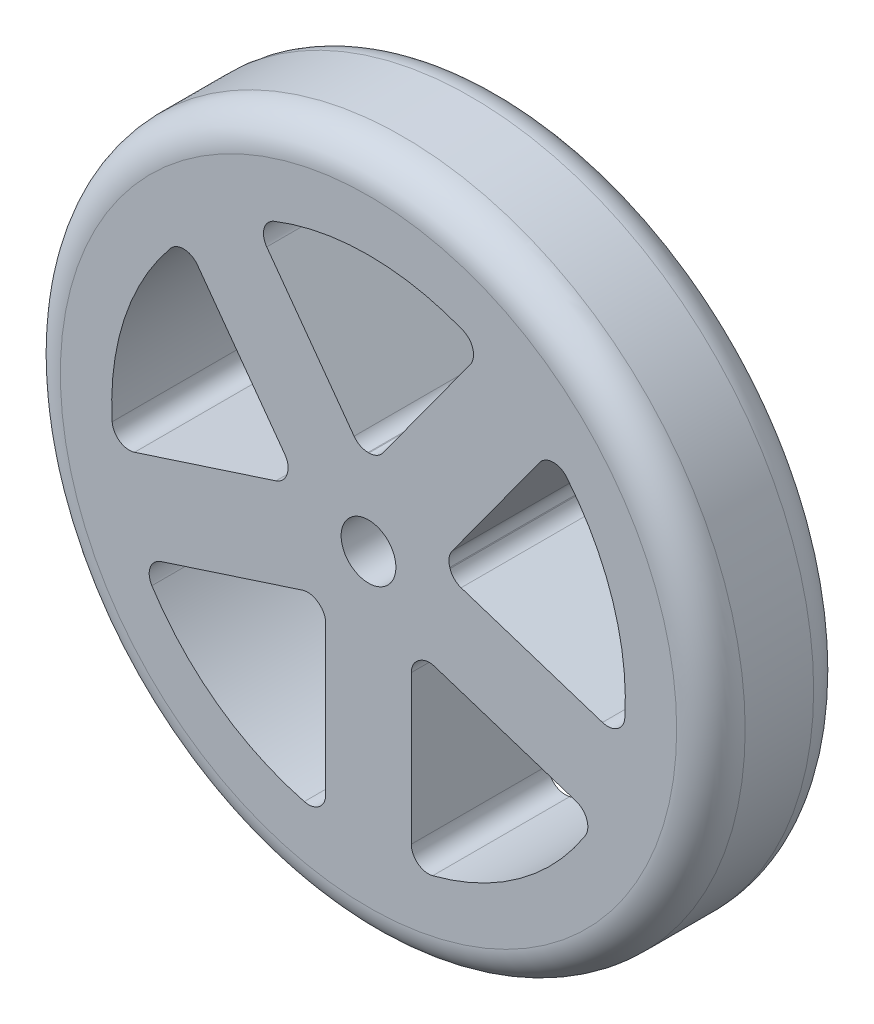
from build123d import *

# Parameters (mm, degrees)
ESQUISSE1_R                  = 100
BOSS_EXTRU_1_DEPTH           = 40
ENL_V_MAT_EXTRU_1_DEPTH      = 147.969384567
ENL_V_MAT_EXTRU_1_DEPTH_BACK = 147.969384567
ENL_V_MAT_EXTRU_2_DEPTH      = 147.969384567
ENL_V_MAT_EXTRU_2_DEPTH_BACK = 147.969384567
ESQUISSE3_R                  = 8
CONG_1_R                     = 5
CONG_2_R                     = 10


with BuildPart() as part:
    # Esquisse1 → Boss.-Extru.1 (new body)
    with BuildSketch(Plane.XY):
        Circle(ESQUISSE1_R)
    extrude(amount=BOSS_EXTRU_1_DEPTH)

    # Esquisse2 → Enlèv. mat.-Extru.1 (cut, two sides: drawn at the far end of the back side and taken through both)
    with BuildSketch(Plane.XY.offset(40).offset(-ENL_V_MAT_EXTRU_1_DEPTH_BACK)):
        with BuildLine():
            Line((2.613211582, 24.863047384), (33.354593169, 67.174929211))
            ThreePointArc((33.354593169, 67.174929211), (0, 75), (-33.354593169, 67.174929211))
            Line((-33.354593169, 67.174929211), (-2.613211582, 24.863047384))
            ThreePointArc((-2.613211582, 24.863047384), (0, 25), (2.613211582, 24.863047384))
        make_face()
        with BuildLine():
            Line((24.453690018, 5.19779227), (74.194290288, -10.96390846))
            ThreePointArc((74.194290288, -10.96390846), (71.329238722, 23.176274578), (53.580018028, 52.480297904))
            Line((53.580018028, 52.480297904), (22.838636441, 10.168416077))
            ThreePointArc((22.838636441, 10.168416077), (23.776412907, 7.725424859), (24.453690018, 5.19779227))
        make_face()
        with BuildLine():
            Line((12.5, -21.650635095), (12.5, -73.950997289))
            ThreePointArc((12.5, -73.950997289), (44.083893922, -60.676274578), (66.468865428, -34.740321367))
            Line((66.468865428, -34.740321367), (16.728265159, -18.578620637))
            ThreePointArc((16.728265159, -18.578620637), (14.694631307, -20.225424859), (12.5, -21.650635095))
        make_face()
        with BuildLine():
            Line((-16.728265159, -18.578620637), (-66.468865428, -34.740321367))
            ThreePointArc((-66.468865428, -34.740321367), (-44.083893922, -60.676274578), (-12.5, -73.950997289))
            Line((-12.5, -73.950997289), (-12.5, -21.650635095))
            ThreePointArc((-12.5, -21.650635095), (-14.694631307, -20.225424859), (-16.728265159, -18.578620637))
        make_face()
        with BuildLine():
            Line((-22.838636441, 10.168416077), (-53.580018028, 52.480297904))
            ThreePointArc((-53.580018028, 52.480297904), (-71.329238722, 23.176274578), (-74.194290288, -10.96390846))
            Line((-74.194290288, -10.96390846), (-24.453690018, 5.19779227))
            ThreePointArc((-24.453690018, 5.19779227), (-23.776412907, 7.725424859), (-22.838636441, 10.168416077))
        make_face()
    extrude(amount=ENL_V_MAT_EXTRU_1_DEPTH + ENL_V_MAT_EXTRU_1_DEPTH_BACK, mode=Mode.SUBTRACT)

    # Esquisse3 → Enlèv. mat.-Extru.2 (cut, two sides: drawn at the far end of the back side and taken through both)
    with BuildSketch(Plane.XY.offset(40).offset(-ENL_V_MAT_EXTRU_2_DEPTH_BACK)):
        Circle(ESQUISSE3_R)
    extrude(amount=ENL_V_MAT_EXTRU_2_DEPTH + ENL_V_MAT_EXTRU_2_DEPTH_BACK, mode=Mode.SUBTRACT)

    # Congé1
    cong_1_edges = [part.edges().sort_by_distance(p)[0] for p in [
        (-24.453690018, 5.19779227, 20),
        (-22.838636441, 10.168416077, 20),
        (-2.613211582, 24.863047384, 20),
        (2.613211582, 24.863047384, 20),
        (22.838636441, 10.168416077, 20),
        (24.453690018, 5.19779227, 20),
        (16.728265159, -18.578620637, 20),
        (12.5, -21.650635095, 20),
        (-12.5, -21.650635095, 20),
        (-16.728265159, -18.578620637, 20),
        (66.468865428, -34.740321367, 20),
        (12.5, -73.950997289, 20),
        (-66.468865428, -34.740321367, 20),
        (-12.5, -73.950997289, 20),
        (-74.194290288, -10.96390846, 20),
        (-53.580018028, 52.480297904, 20),
        (-33.354593169, 67.174929211, 20),
        (33.354593169, 67.174929211, 20),
        (53.580018028, 52.480297904, 20),
        (74.194290288, -10.96390846, 20),
    ]]
    fillet(cong_1_edges, radius=CONG_1_R)

    # Congé2
    cong_2_edges = [part.edges().sort_by_distance(p)[0] for p in [
        (-100, 0, 0),
        (-100, 0, 40),
    ]]
    fillet(cong_2_edges, radius=CONG_2_R)


solid = part.part
